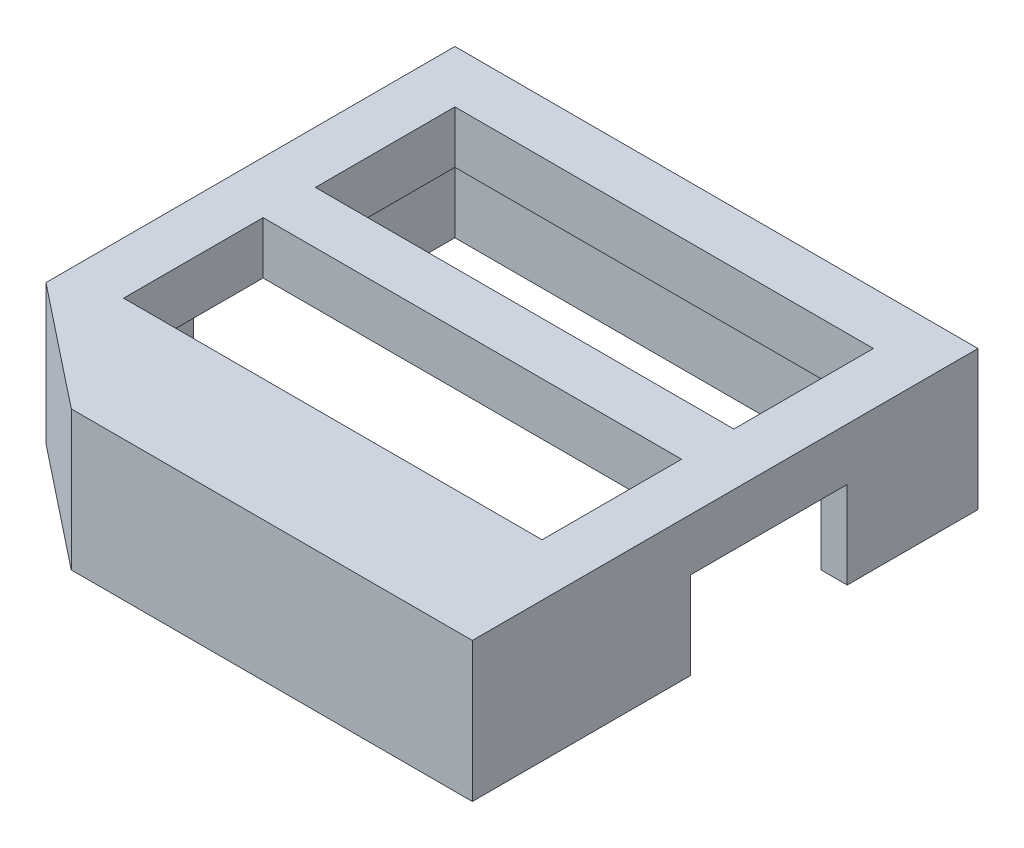
from build123d import *

# Parameters (mm, degrees)
SKETCH1_W           = 30
SKETCH1_H           = 29
BOSS_EXTRUDE1_DEPTH = 8
SKETCH2_W           = 24
SKETCH2_H           = 8
CUT_EXTRUDE1_DEPTH  = 8
CUT_EXTRUDE2_DEPTH  = 8
CUT_EXTRUDE3_DEPTH  = 5
SKETCH5_W           = 9
SKETCH5_H           = 5
CUT_EXTRUDE4_DEPTH  = 30


with BuildPart() as part:
    # Sketch1 → Boss-Extrude1 (new body)
    with BuildSketch(Plane(origin=(0, 0, 0), x_dir=(1, 0, 0), z_dir=(0, 1, 0))):
        with Locations((-14.236607143, -13.569196429)):
            Rectangle(SKETCH1_W, SKETCH1_H)
    extrude(amount=BOSS_EXTRUDE1_DEPTH)

    # Sketch2 → Cut-Extrude1 (cut)
    with BuildSketch(Plane(origin=(0, 8, 0), x_dir=(1, 0, 0), z_dir=(0, 1, 0))):
        with Locations((-14.236607143, -6.069196429)):
            Rectangle(SKETCH2_W, SKETCH2_H)
        with Locations((-14.236607143, -17.069196429)):
            Rectangle(SKETCH2_W, SKETCH2_H)
    extrude(amount=-CUT_EXTRUDE1_DEPTH, mode=Mode.SUBTRACT)

    # Sketch3 → Cut-Extrude2 (cut)
    with BuildSketch(Plane(origin=(0, 8, 0), x_dir=(1, 0, 0), z_dir=(0, 1, 0))):
        Polygon((-29.236607143, -22.519140749), (-22.236607143, -28.069196429), (-29.236607143, -28.069196429), align=None)
    extrude(amount=-CUT_EXTRUDE2_DEPTH, mode=Mode.SUBTRACT)

    # Sketch4 → Cut-Extrude3 (cut)
    with BuildSketch(Plane.XZ):
        Polygon((-0.736607143, 0.569196429), (-27.736607143, 0.569196429), (-27.736607143, 21.794168589), (-21.714109927, 26.569196429), (-0.736607143, 26.569196429), align=None)
    extrude(amount=-CUT_EXTRUDE3_DEPTH, mode=Mode.SUBTRACT)

    # Sketch5 → Cut-Extrude4 (cut)
    with BuildSketch(Plane.ZY.offset(29.236607143)):
        with Locations((11.069196429, 2.5)):
            Rectangle(SKETCH5_W, SKETCH5_H)
    extrude(amount=-CUT_EXTRUDE4_DEPTH, mode=Mode.SUBTRACT)


solid = part.part
